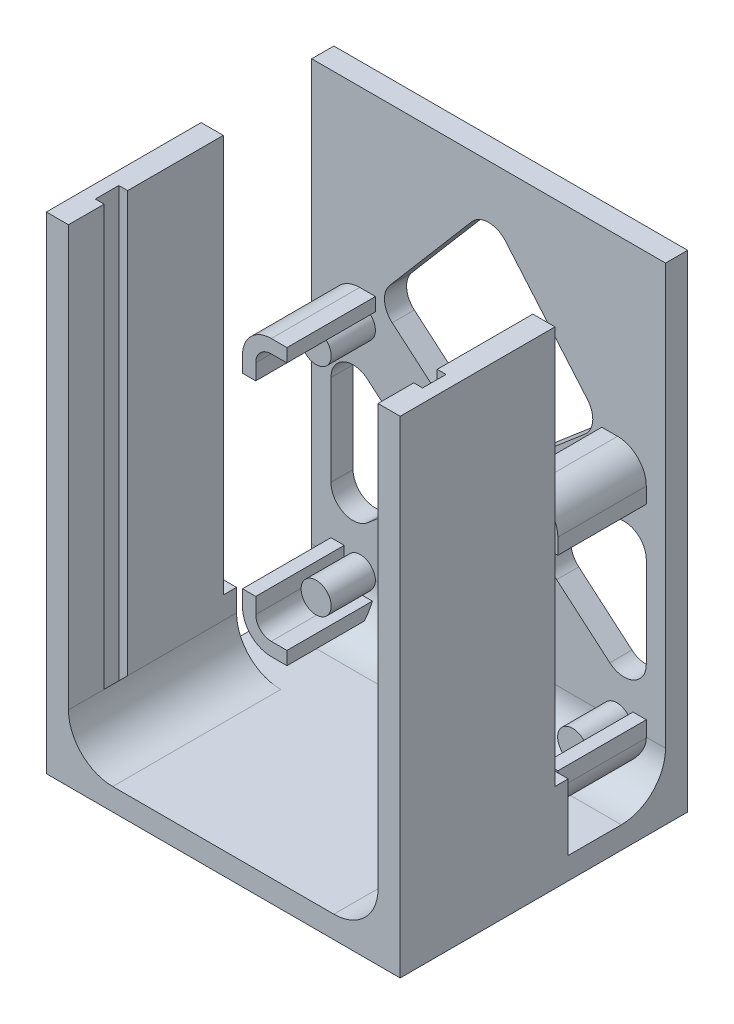
from build123d import *

# Parameters (mm, degrees)
SKETCH1_W           = 80
SKETCH1_H           = 110
BOSS_EXTRUDE1_DEPTH = 5
SKETCH1_3_R         = 3.4
BOSS_EXTRUDE3_DEPTH = 15
BOSS_EXTRUDE4_DEPTH = 25
SKETCH2_W           = 80
SKETCH2_H           = 5
BOSS_EXTRUDE5_DEPTH = 60
SKETCH3_W           = 5
SKETCH3_H           = 38
BOSS_EXTRUDE6_DEPTH = 15
SKETCH4_W           = 5
SKETCH4_H           = 35
BOSS_EXTRUDE7_DEPTH = 90
FILLET1_R           = 10
CUT_EXTRUDE1_START  = -105
SKETCH5_W           = 2
SKETCH5_H           = 5.3
CUT_EXTRUDE1_DEPTH  = 105
CUT_EXTRUDE2_REACH  = 92.692
FILLET2_R           = 5


with BuildPart() as part:
    # Sketch1 → Boss-Extrude1 (new body)
    with BuildSketch(Plane.XY):
        Rectangle(SKETCH1_W, SKETCH1_H)
    extrude(amount=BOSS_EXTRUDE1_DEPTH)

    # Sketch1<3> → Boss-Extrude3 (add)
    with BuildSketch(Plane.XY):
        with Locations((-29, 9)):
            Circle(SKETCH1_3_R)
        with Locations((29, 9)):
            Circle(SKETCH1_3_R)
        with Locations((29, -40)):
            Circle(SKETCH1_3_R)
        with Locations((-29, -40)):
            Circle(SKETCH1_3_R)
    extrude(amount=BOSS_EXTRUDE3_DEPTH)

    # Sketch1<4> → Boss-Extrude4 (add)
    with BuildSketch(Plane.XY):
        with BuildLine():
            Line((-25.6, 15.65), (-29.15, 15.65))
            ThreePointArc((-29.15, 15.65), (-33.746194078, 13.746194078), (-35.65, 9.15))
            Line((-35.65, 9.15), (-35.65, 5.6))
            Line((-35.65, 5.6), (-32.65, 5.6))
            Line((-32.65, 5.6), (-32.65, 9.15))
            ThreePointArc((-32.65, 9.15), (-31.624873734, 11.624873734), (-29.15, 12.65))
            Line((-29.15, 12.65), (-25.6, 12.65))
            Line((-25.6, 12.65), (-25.6, 15.65))
        make_face()
        with BuildLine():
            Line((29.15, 15.65), (25.6, 15.65))
            Line((25.6, 15.65), (25.6, 12.65))
            Line((25.6, 12.65), (29.15, 12.65))
            ThreePointArc((29.15, 12.65), (31.624873734, 11.624873734), (32.65, 9.15))
            Line((32.65, 9.15), (32.65, 5.6))
            Line((32.65, 5.6), (35.65, 5.6))
            Line((35.65, 5.6), (35.65, 9.15))
            ThreePointArc((35.65, 9.15), (33.746194078, 13.746194078), (29.15, 15.65))
        make_face()
        with BuildLine():
            Line((35.65, -40.15), (35.65, -36.6))
            Line((35.65, -36.6), (32.65, -36.6))
            Line((32.65, -36.6), (32.65, -40.15))
            ThreePointArc((32.65, -40.15), (31.624873734, -42.624873734), (29.15, -43.65))
            Line((29.15, -43.65), (25.6, -43.65))
            Line((25.6, -43.65), (25.6, -46.65))
            Line((25.6, -46.65), (29.15, -46.65))
            ThreePointArc((29.15, -46.65), (33.746194078, -44.746194078), (35.65, -40.15))
        make_face()
        with BuildLine():
            Line((-32.65, -36.6), (-35.65, -36.6))
            Line((-35.65, -36.6), (-35.65, -40.15))
            ThreePointArc((-35.65, -40.15), (-33.746194078, -44.746194078), (-29.15, -46.65))
            Line((-29.15, -46.65), (-25.6, -46.65))
            Line((-25.6, -46.65), (-25.6, -43.65))
            Line((-25.6, -43.65), (-29.15, -43.65))
            ThreePointArc((-29.15, -43.65), (-31.624873734, -42.624873734), (-32.65, -40.15))
            Line((-32.65, -40.15), (-32.65, -36.6))
        make_face()
    extrude(amount=BOSS_EXTRUDE4_DEPTH)

    # Sketch2 → Boss-Extrude5 (add)
    with BuildSketch(Plane.XY.offset(5)):
        with Locations((0, -52.5)):
            Rectangle(SKETCH2_W, SKETCH2_H)
    extrude(amount=BOSS_EXTRUDE5_DEPTH)

    # Sketch3 → Boss-Extrude6 (add)
    with BuildSketch(Plane(origin=(0, -50, 0), x_dir=(1, 0, 0), z_dir=(0, 1, 0))):
        with Locations((-37.5, -46)):
            Rectangle(SKETCH3_W, SKETCH3_H)
        with Locations((37.5, -46)):
            Rectangle(SKETCH3_W, SKETCH3_H)
    extrude(amount=BOSS_EXTRUDE6_DEPTH)

    # Sketch4 → Boss-Extrude7 (add)
    with BuildSketch(Plane(origin=(0, -35, 0), x_dir=(1, 0, 0), z_dir=(0, 1, 0))):
        with Locations((-37.5, -47.5)):
            Rectangle(SKETCH4_W, SKETCH4_H)
        with Locations((37.5, -47.5)):
            Rectangle(SKETCH4_W, SKETCH4_H)
    extrude(amount=BOSS_EXTRUDE7_DEPTH)

    # Fillet1
    # the kernel refuses this fillet: 10 mm, written as the material it adds along each edge
    with BuildSketch(Plane(origin=(-35, -50, 65), x_dir=(1, 0, 0), z_dir=(0, 0, -1)), Plane(origin=(35, -50, 27), x_dir=(-1, 0, 0), z_dir=(0, 0, 1))) as fillet1_piece_1:
        with BuildLine():
            CenterArc((FILLET1_R, -FILLET1_R), FILLET1_R, 90, 90)
            Line((0, -FILLET1_R), (0, 0))
            Line((0, 0), (FILLET1_R, 0))
        make_face()
    extrude(amount=38)
    with BuildSketch(Plane(origin=(40, -50, 5), x_dir=(0, 1, 0), z_dir=(-1, 0, 0))) as fillet1_piece_2:
        with BuildLine():
            CenterArc((FILLET1_R, -FILLET1_R), FILLET1_R, 90, 90)
            Line((0, -FILLET1_R), (0, 0))
            Line((0, 0), (FILLET1_R, 0))
        make_face()
    extrude(amount=80)

    # Sketch5 → Cut-Extrude1 (cut)
    with BuildSketch(Plane(origin=(0, 55, 0), x_dir=(1, 0, 0), z_dir=(0, 1, 0)).offset(CUT_EXTRUDE1_START)):
        with Locations((-36, -54.275)):
            Rectangle(SKETCH5_W, SKETCH5_H)
        with Locations((36, -54.275)):
            Rectangle(SKETCH5_W, SKETCH5_H)
    extrude(amount=CUT_EXTRUDE1_DEPTH, mode=Mode.SUBTRACT)

    # Sketch6 → Cut-Extrude2 (cut, up to next)
    with BuildSketch(Plane.XY.offset(5), mode=Mode.PRIVATE) as cut_extrude2_sk1:
        Polygon((0, 45.659569378), (25.6, 15.65), (-25.6, 15.65), align=None)
    cut_extrude2_tool1 = extrude(cut_extrude2_sk1.sketch, amount=-CUT_EXTRUDE2_REACH, mode=Mode.PRIVATE) & part.part
    # Sketch6 → Cut-Extrude2 (cut, up to next)
    with BuildSketch(Plane.XY.offset(5), mode=Mode.PRIVATE) as cut_extrude2_sk2:
        Polygon((-25.6, 15.65), (0, -6.188367347), (25.6, 15.65), align=None)
    cut_extrude2_tool2 = extrude(cut_extrude2_sk2.sketch, amount=-CUT_EXTRUDE2_REACH, mode=Mode.PRIVATE) & part.part
    # Sketch6 → Cut-Extrude2 (cut, up to next)
    with BuildSketch(Plane.XY.offset(5), mode=Mode.PRIVATE) as cut_extrude2_sk3:
        Polygon((-35.65, -36.6), (-10.915550239, -15.5), (-35.65, 5.6), align=None)
    cut_extrude2_tool3 = extrude(cut_extrude2_sk3.sketch, amount=-CUT_EXTRUDE2_REACH, mode=Mode.PRIVATE) & part.part
    # Sketch6 → Cut-Extrude2 (cut, up to next)
    with BuildSketch(Plane.XY.offset(5), mode=Mode.PRIVATE) as cut_extrude2_sk4:
        Polygon((-17.804545455, -40), (17.804545455, -40), (0, -24.811632653), align=None)
    cut_extrude2_tool4 = extrude(cut_extrude2_sk4.sketch, amount=-CUT_EXTRUDE2_REACH, mode=Mode.PRIVATE) & part.part
    # Sketch6 → Cut-Extrude2 (cut, up to next)
    with BuildSketch(Plane.XY.offset(5), mode=Mode.PRIVATE) as cut_extrude2_sk5:
        Polygon((10.915550239, -15.5), (35.65, -36.6), (35.65, 5.6), align=None)
    cut_extrude2_tool5 = extrude(cut_extrude2_sk5.sketch, amount=-CUT_EXTRUDE2_REACH, mode=Mode.PRIVATE) & part.part
    add(cut_extrude2_tool1.solids().sort_by_distance((0, 25.65319, 5))[0], mode=Mode.SUBTRACT)
    add(cut_extrude2_tool2.solids().sort_by_distance((0, 8.370544, 5))[0], mode=Mode.SUBTRACT)
    add(cut_extrude2_tool3.solids().sort_by_distance((-27.405183, -15.5, 5))[0], mode=Mode.SUBTRACT)
    add(cut_extrude2_tool4.solids().sort_by_distance((0, -34.937211, 5))[0], mode=Mode.SUBTRACT)
    add(cut_extrude2_tool5.solids().sort_by_distance((27.405183, -15.5, 5))[0], mode=Mode.SUBTRACT)

    # Fillet2
    # the kernel refuses this fillet: 5 mm, written as the material it adds along each edge
    with BuildSketch(Plane(origin=(17.804545455, -40, 5), x_dir=(-1, 0, 0), z_dir=(0, 0, -1))) as fillet2_piece_1:
        with BuildLine():
            CenterArc((FILLET2_R * 2.71308210373, FILLET2_R), FILLET2_R, 130.466208854, 139.533791146)
            Line((FILLET2_R * 2.06408263048, FILLET2_R * 1.7607888562), (0, 0))
            Line((0, 0), (FILLET2_R * 2.71308210373, 0))
        make_face()
    extrude(amount=5)
    with BuildSketch(Plane(origin=(0, -24.811632653, 5), x_dir=(0.7607888562020934, -0.6489994732499483, 0), z_dir=(0, 0, -1)), Plane(origin=(0, -6.188367347, 5), x_dir=(-0.7607888562020926, 0.6489994732499494, 0), z_dir=(0, 0, -1))) as fillet2_piece_2:
        with BuildLine():
            CenterArc((FILLET2_R * 0.85306122449, FILLET2_R), FILLET2_R, 189.067582292, 80.932417708)
            Line((-FILLET2_R * 0.134441909369, FILLET2_R * 0.842400632557), (0, 0))
            Line((0, 0), (FILLET2_R * 0.85306122449, 0))
        make_face()
    extrude(amount=5)
    with BuildSketch(Plane(origin=(-17.804545455, -40, 5), x_dir=(1, 0, 0), z_dir=(0, 0, -1))) as fillet2_piece_3:
        with BuildLine():
            CenterArc((FILLET2_R * 2.71308210373, -FILLET2_R), FILLET2_R, 90, 139.533791146)
            Line((FILLET2_R * 2.06408263048, -FILLET2_R * 1.7607888562), (0, 0))
            Line((0, 0), (FILLET2_R * 2.71308210373, 0))
        make_face()
    extrude(amount=5)
    with BuildSketch(Plane(origin=(-35.65, 5.6, 5), x_dir=(0, -1, 0), z_dir=(0, 0, -1)), Plane(origin=(35.65, -36.6, 5), x_dir=(0, 1, 0), z_dir=(0, 0, -1))) as fillet2_piece_4:
        with BuildLine():
            CenterArc((FILLET2_R * 2.16748636604, -FILLET2_R), FILLET2_R, 90, 130.466208854)
            Line((FILLET2_R * 1.40669750983, -FILLET2_R * 1.64899947325), (0, 0))
            Line((0, 0), (FILLET2_R * 2.16748636604, 0))
        make_face()
    extrude(amount=5)
    with BuildSketch(Plane(origin=(-10.915550239, -15.5, 5), x_dir=(-0.7607888562020928, -0.6489994732499492, 0), z_dir=(0, 0, -1)), Plane(origin=(10.915550239, -15.5, 5), x_dir=(0.760788856202093, 0.648999473249949, 0), z_dir=(0, 0, -1)), Plane(origin=(0, 45.659569378, 5), x_dir=(0.6489994732499487, -0.7607888562020931, 0), z_dir=(0, 0, -1))) as fillet2_piece_5:
        with BuildLine():
            CenterArc((FILLET2_R * 1.17224880383, FILLET2_R), FILLET2_R, 170.932417708, 99.067582292)
            Line((FILLET2_R * 0.184745669969, FILLET2_R * 1.15759936744), (0, 0))
            Line((0, 0), (FILLET2_R * 1.17224880383, 0))
        make_face()
    extrude(amount=5)
    with BuildSketch(Plane(origin=(-35.65, -36.6, 5), x_dir=(0, 1, 0), z_dir=(0, 0, -1)), Plane(origin=(35.65, 5.6, 5), x_dir=(0, -1, 0), z_dir=(0, 0, -1))) as fillet2_piece_6:
        with BuildLine():
            CenterArc((FILLET2_R * 2.16748636604, FILLET2_R), FILLET2_R, 139.533791146, 130.466208854)
            Line((FILLET2_R * 1.40669750983, FILLET2_R * 1.64899947325), (0, 0))
            Line((0, 0), (FILLET2_R * 2.16748636604, 0))
        make_face()
    extrude(amount=5)
    with BuildSketch(Plane(origin=(25.6, 15.65, 5), x_dir=(-0.6489994732499493, 0.7607888562020927, 0), z_dir=(0, 0, -1))) as fillet2_piece_7:
        with BuildLine():
            CenterArc((FILLET2_R, -FILLET2_R), FILLET2_R, 90, 90)
            Line((0, -FILLET2_R), (0, 0))
            Line((0, 0), (FILLET2_R, 0))
        make_face()
    extrude(amount=5)
    with BuildSketch(Plane(origin=(-25.6, 15.65, 5), x_dir=(0.648999473249949, 0.7607888562020928, 0), z_dir=(0, 0, -1))) as fillet2_piece_8:
        with BuildLine():
            CenterArc((FILLET2_R, FILLET2_R), FILLET2_R, 180, 90)
            Line((0, FILLET2_R), (0, 0))
            Line((0, 0), (FILLET2_R, 0))
        make_face()
    extrude(amount=5)


solid = part.part
